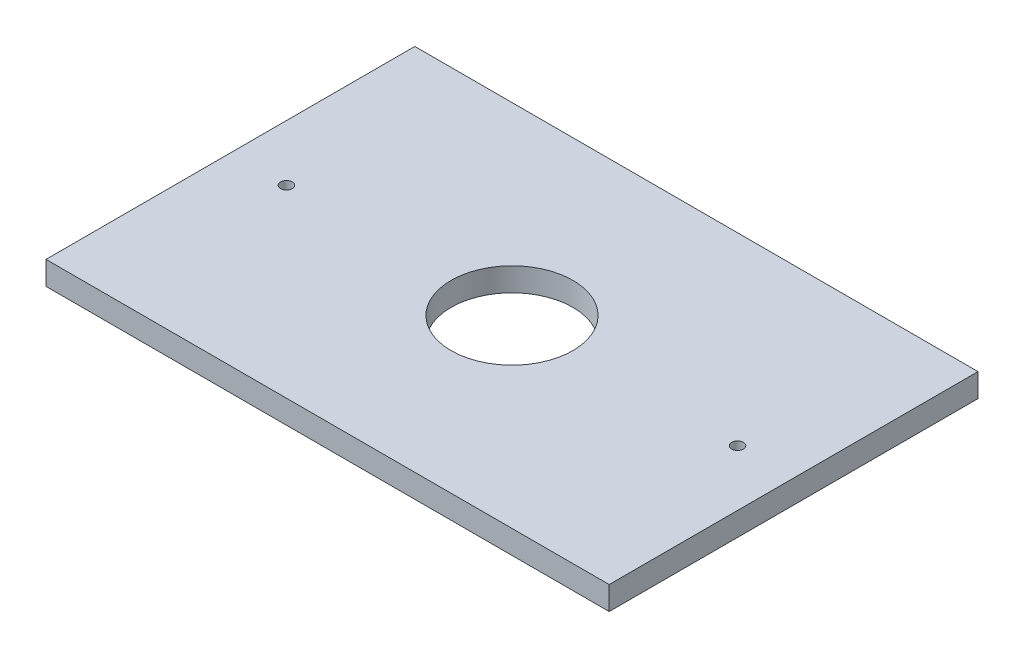
from build123d import *

# Parameters (mm, degrees)
SKETCH1_W           = 152.7
SKETCH1_H           = 100
BOSS_EXTRUDE1_DEPTH = 6.35
SKETCH2_R           = 16.51
CUT_EXTRUDE1_DEPTH  = 10
SKETCH3_R           = 1.5875
CUT_EXTRUDE2_DEPTH  = 10


with BuildPart() as part:
    # Sketch1 → Boss-Extrude1 (new body)
    with BuildSketch(Plane(origin=(0, 0, 0), x_dir=(1, 0, 0), z_dir=(0, 1, 0))):
        with Locations((76.35, 50)):
            Rectangle(SKETCH1_W, SKETCH1_H)
    extrude(amount=BOSS_EXTRUDE1_DEPTH)

    # Sketch2 → Cut-Extrude1 (cut)
    with BuildSketch(Plane(origin=(0, 6.35, 0), x_dir=(1, 0, 0), z_dir=(0, 1, 0))):
        with Locations((76.35, 50)):
            Circle(SKETCH2_R)
    extrude(amount=-CUT_EXTRUDE1_DEPTH, mode=Mode.SUBTRACT)

    # Sketch3 → Cut-Extrude2 (cut)
    with BuildSketch(Plane(origin=(0, 6.35, 0), x_dir=(1, 0, 0), z_dir=(0, 1, 0))):
        with Locations((15.2, 50)):
            Circle(SKETCH3_R)
        with Locations((137.5, 50)):
            Circle(SKETCH3_R)
    extrude(amount=-CUT_EXTRUDE2_DEPTH, mode=Mode.SUBTRACT)


solid = part.part
